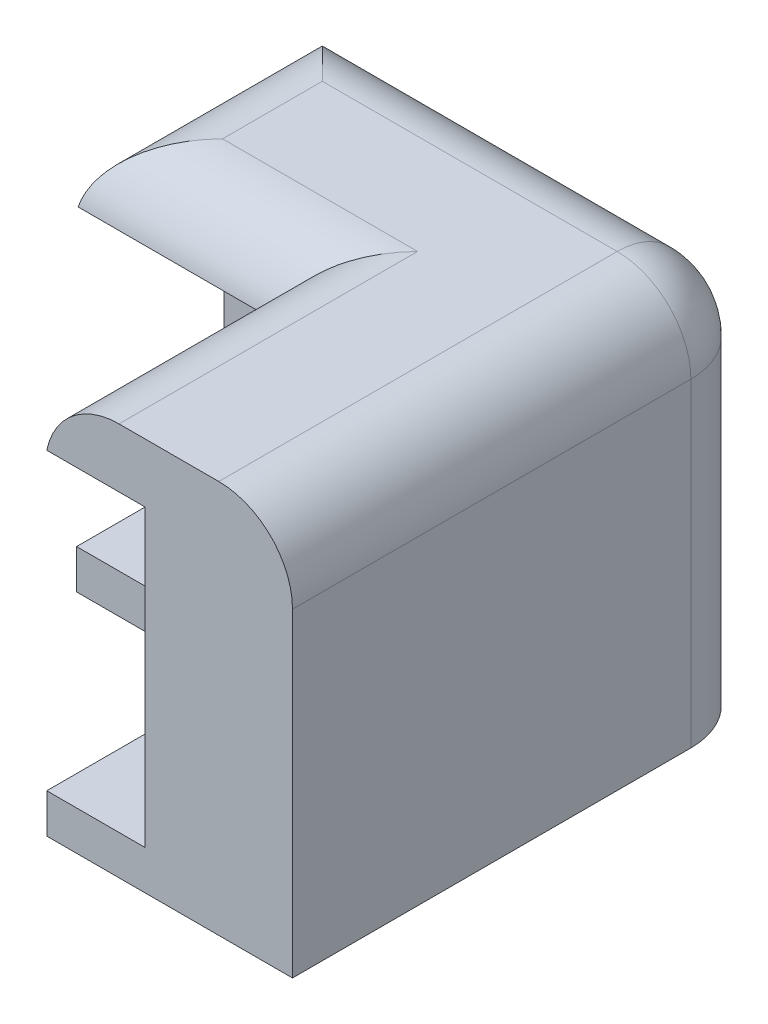
from build123d import *

# Parameters (mm, degrees)
SKETCH_221_W        = 218
SKETCH_221_H        = 134
SKETCH_221_W_2      = 198
SKETCH_221_H_2      = 114
EXTRUDE_2_DEPTH     = 16
SKETCH_2_W          = 126
SKETCH_2_H          = 12
CUT_EXTRUDE_1_DEPTH = 212
SKETCH_3_W          = 182
SKETCH_3_H          = 14.4
CUT_EXTRUDE_2_DEPTH = 134
SKETCH_4_R          = 1
CUT_EXTRUDE_3_DEPTH = 1.6
FILLET_1_R          = 3
FILLET_2_R          = 3
FILLET_3_R          = 3
SKETCH_6_W          = 206.897999361
SKETCH_6_H          = 19.177389722
CUT_EXTRUDE_5_DEPTH = 200
SKETCH_7_W          = 123.024935324
SKETCH_7_H          = 17.566945153
CUT_EXTRUDE_6_DEPTH = 300


with BuildPart() as part:
    # Sketch 221 → Бобышка-Вытянуть2 (new body)
    with BuildSketch(Plane(origin=(0, 0, 0), x_dir=(1, 0, 0), z_dir=(0, 1, 0))):
        Rectangle(SKETCH_221_W, SKETCH_221_H)
        Rectangle(SKETCH_221_W_2, SKETCH_221_H_2, mode=Mode.SUBTRACT)
    extrude(amount=EXTRUDE_2_DEPTH)

    # Эскиз2 → Вырез-Вытянуть1 (cut)
    with BuildSketch(Plane.ZY.offset(109)):
        with Locations((0, 7.6)):
            Rectangle(SKETCH_2_W, SKETCH_2_H)
    extrude(amount=-CUT_EXTRUDE_1_DEPTH, mode=Mode.SUBTRACT)

    # Эскиз3 → Вырез-Вытянуть2 (cut)
    with BuildSketch(Plane.XY.offset(67)):
        with Locations((0, 8.8)):
            Rectangle(SKETCH_3_W, SKETCH_3_H)
    extrude(amount=-CUT_EXTRUDE_2_DEPTH, mode=Mode.SUBTRACT)

    # Эскиз4 → Вырез-Вытянуть3 (cut)
    with BuildSketch(Plane(origin=(0, 1.6, 0), x_dir=(1, 0, 0), z_dir=(0, 1, 0))):
        with Locations(Location((-74.698916604, 62, 0), (0, 0, 270))):
            Circle(SKETCH_4_R)
        with Locations(Location((-74.698916604, -62, 0), (0, 0, 270))):
            Circle(SKETCH_4_R)
        with Locations(Location((74.698916604, -62, 0), (0, 0, 90))):
            Circle(SKETCH_4_R)
        with Locations(Location((74.698916604, 62, 0), (0, 0, 90))):
            Circle(SKETCH_4_R)
    extrude(amount=-CUT_EXTRUDE_3_DEPTH, mode=Mode.SUBTRACT)

    # Скругление1
    fillet_1_edges = [part.edges().sort_by_distance(p)[0] for p in [
        (109, 8, 67),
        (-109, 8, 67),
        (-109, 8, -67),
        (109, 8, -67),
    ]]
    fillet(fillet_1_edges, radius=FILLET_1_R)

    # Скругление2
    # the kernel refuses this fillet: 3 mm, written as the material it takes off along each edge
    with BuildSketch(Plane(origin=(-91, 16, -49.5), x_dir=(-1, 0, 0), z_dir=(0, 0, -1)), Plane(origin=(-91, 16, 74.5), x_dir=(-1, 0, 0), z_dir=(0, 0, -1))) as fillet_2_piece_1:
        with BuildLine():
            CenterArc((FILLET_2_R, -FILLET_2_R), FILLET_2_R, 90, 90)
            Line((0, -FILLET_2_R), (0, 0))
            Line((0, 0), (FILLET_2_R, 0))
        make_face()
    extrude(amount=25, mode=Mode.SUBTRACT)
    with BuildSketch(Plane(origin=(-83.651530772, 16, -57), x_dir=(0, 0, -1), z_dir=(-1, 0, 0)), Plane(origin=(-99, 16, 57), x_dir=(0, 0, 1), z_dir=(1, 0, 0))) as fillet_2_piece_2:
        with BuildLine():
            CenterArc((2.939387691, 3), FILLET_2_R, 191.536959033, 78.463040967)
            Line((0, 2.4), (0, 0))
            Line((0, 0), (2.939387691, 0))
        make_face()
    extrude(amount=15.348469228, mode=Mode.SUBTRACT)
    with BuildSketch(Plane(origin=(-99, 16, -57), x_dir=(-1, 0, 0), z_dir=(0, 0, 1))) as fillet_2_piece_3:
        with BuildLine():
            CenterArc((2.939387691, 3), FILLET_2_R, 191.536959033, 78.463040967)
            Line((0, 2.4), (0, 0))
            Line((0, 0), (2.939387691, 0))
        make_face()
    extrude(amount=114, mode=Mode.SUBTRACT)
    with BuildSketch(Plane(origin=(-106, 16, 67), x_dir=(0, -1, 0), z_dir=(1, 0, 0))) as fillet_2_piece_4:
        with BuildLine():
            CenterArc((FILLET_2_R, FILLET_2_R), FILLET_2_R, 180, 90)
            Line((0, FILLET_2_R), (0, 0))
            Line((0, 0), (FILLET_2_R, 0))
        make_face()
    extrude(amount=22.5, mode=Mode.SUBTRACT)
    with BuildSketch(Plane(origin=(-106, 16, 64), x_dir=(0, 0, 1), z_dir=(1, 0, 0))) as fillet_2_piece_5:
        with BuildLine():
            CenterArc((3 - FILLET_2_R, FILLET_2_R), FILLET_2_R, 270, 90)
            Line((3 - FILLET_2_R, 0), (3, 0))
            Line((3, 0), (3, FILLET_2_R))
        make_face()
    revolve(axis=Axis((-106, 16, 64), (0, -1, 0)), revolution_arc=90, mode=Mode.SUBTRACT)
    with BuildSketch(Plane(origin=(-109, 16, -64), x_dir=(1, 0, 0), z_dir=(0, 0, 1))) as fillet_2_piece_6:
        with BuildLine():
            CenterArc((FILLET_2_R, -FILLET_2_R), FILLET_2_R, 90, 90)
            Line((0, -FILLET_2_R), (0, 0))
            Line((0, 0), (FILLET_2_R, 0))
        make_face()
    extrude(amount=128, mode=Mode.SUBTRACT)
    with BuildSketch(Plane(origin=(-106, 16, -64), x_dir=(-1, 0, 0), z_dir=(0, 0, 1))) as fillet_2_piece_7:
        with BuildLine():
            CenterArc((3 - FILLET_2_R, FILLET_2_R), FILLET_2_R, 270, 90)
            Line((3, FILLET_2_R), (3, 0))
            Line((3, 0), (3 - FILLET_2_R, 0))
        make_face()
    revolve(axis=Axis((-106, 16, -64), (0, -1, 0)), revolution_arc=90, mode=Mode.SUBTRACT)
    with BuildSketch(Plane(origin=(-83.5, 16, -67), x_dir=(0, 0, 1), z_dir=(-1, 0, 0))) as fillet_2_piece_8:
        with BuildLine():
            CenterArc((FILLET_2_R, -FILLET_2_R), FILLET_2_R, 90, 90)
            Line((0, -FILLET_2_R), (0, 0))
            Line((0, 0), (FILLET_2_R, 0))
        make_face()
    extrude(amount=22.5, mode=Mode.SUBTRACT)
    with BuildSketch(Plane(origin=(-91, 16, -57), x_dir=(0, 0, -1), z_dir=(-1, 0, 0))) as fillet_2_piece_9a_section:
        with BuildLine():
            CenterArc((2.939387691, 3), FILLET_2_R, 191.536959033, 78.463040967)
            Line((0, 2.4), (0, 0))
            Line((0, 0), (2.939387691, 0))
        make_face()
    fillet_2_piece_9a = extrude(amount=15.348469228, mode=Mode.PRIVATE)
    fillet_2_piece_9a = split(fillet_2_piece_9a, bisect_by=Plane(origin=(-99, 16, -57), z_dir=(-1, 0, 0)), keep=Keep.TOP, mode=Mode.PRIVATE)
    with BuildSketch(Plane(origin=(-99, 16, -64.348469228), x_dir=(-1, 0, 0), z_dir=(0, 0, 1))) as fillet_2_piece_9b_section:
        with BuildLine():
            CenterArc((2.939387691, 3), FILLET_2_R, 191.536959033, 78.463040967)
            Line((0, 2.4), (0, 0))
            Line((0, 0), (2.939387691, 0))
        make_face()
    fillet_2_piece_9b = extrude(amount=121.348469228, mode=Mode.PRIVATE)
    fillet_2_piece_9b = split(fillet_2_piece_9b, bisect_by=Plane(origin=(-99, 16, -57), z_dir=(0, 0, -1)), keep=Keep.TOP, mode=Mode.PRIVATE)
    fillet_2_piece_9b = split(fillet_2_piece_9b, bisect_by=Plane(origin=(-99, 16, -63), z_dir=(0, 0, 1)), keep=Keep.TOP, mode=Mode.PRIVATE)
    fillet_2_piece_9 = fillet_2_piece_9a & fillet_2_piece_9b
    add(fillet_2_piece_9, mode=Mode.SUBTRACT)
    with BuildSketch(Plane(origin=(-106.348469228, 16, 57), x_dir=(0, 0, 1), z_dir=(1, 0, 0))) as fillet_2_piece_10a_section:
        with BuildLine():
            CenterArc((2.939387691, 3), FILLET_2_R, 191.536959033, 78.463040967)
            Line((0, 2.4), (0, 0))
            Line((0, 0), (2.939387691, 0))
        make_face()
    fillet_2_piece_10a = extrude(amount=15.348469228, mode=Mode.PRIVATE)
    fillet_2_piece_10a = split(fillet_2_piece_10a, bisect_by=Plane(origin=(-99, 16, 57), z_dir=(-1, 0, 0)), keep=Keep.TOP, mode=Mode.PRIVATE)
    with BuildSketch(Plane(origin=(-99, 16, -57), x_dir=(-1, 0, 0), z_dir=(0, 0, 1))) as fillet_2_piece_10b_section:
        with BuildLine():
            CenterArc((2.939387691, 3), FILLET_2_R, 191.536959033, 78.463040967)
            Line((0, 2.4), (0, 0))
            Line((0, 0), (2.939387691, 0))
        make_face()
    fillet_2_piece_10b = extrude(amount=121.348469228, mode=Mode.PRIVATE)
    fillet_2_piece_10b = split(fillet_2_piece_10b, bisect_by=Plane(origin=(-99, 16, 57), z_dir=(0, 0, 1)), keep=Keep.TOP, mode=Mode.PRIVATE)
    fillet_2_piece_10b = split(fillet_2_piece_10b, bisect_by=Plane(origin=(-99, 16, 63), z_dir=(0, 0, -1)), keep=Keep.TOP, mode=Mode.PRIVATE)
    fillet_2_piece_10 = fillet_2_piece_10a & fillet_2_piece_10b
    add(fillet_2_piece_10, mode=Mode.SUBTRACT)

    # Скругление3
    # the kernel refuses this fillet: 3 mm, written as the material it takes off along each edge
    with BuildSketch(Plane(origin=(106, 16, 64), x_dir=(0, 0, 1), z_dir=(-1, 0, 0))) as fillet_3_piece_1:
        with BuildLine():
            CenterArc((3 - FILLET_3_R, -FILLET_3_R), FILLET_3_R, 0, 90)
            Line((3, -FILLET_3_R), (3, 0))
            Line((3, 0), (3 - FILLET_3_R, 0))
        make_face()
    revolve(axis=Axis((106, 16, 64), (0, 1, 0)), revolution_arc=90, mode=Mode.SUBTRACT)
    with BuildSketch(Plane(origin=(83.5, 16, 67), x_dir=(0, -1, 0), z_dir=(1, 0, 0)), Plane(origin=(106, 16, -67), x_dir=(0, -1, 0), z_dir=(-1, 0, 0))) as fillet_3_piece_2:
        with BuildLine():
            CenterArc((FILLET_3_R, FILLET_3_R), FILLET_3_R, 180, 90)
            Line((0, FILLET_3_R), (0, 0))
            Line((0, 0), (FILLET_3_R, 0))
        make_face()
    extrude(amount=22.5, mode=Mode.SUBTRACT)
    with BuildSketch(Plane(origin=(91, 16, 74.5), x_dir=(0, -1, 0), z_dir=(0, 0, -1)), Plane(origin=(91, 16, -49.5), x_dir=(0, -1, 0), z_dir=(0, 0, -1))) as fillet_3_piece_3:
        with BuildLine():
            CenterArc((FILLET_3_R, -FILLET_3_R), FILLET_3_R, 90, 90)
            Line((0, -FILLET_3_R), (0, 0))
            Line((0, 0), (FILLET_3_R, 0))
        make_face()
    extrude(amount=25, mode=Mode.SUBTRACT)
    with BuildSketch(Plane(origin=(83.651530772, 16, 57), x_dir=(0, -1.0, 1.5720758028687117e-12), z_dir=(1, 0, 0)), Plane(origin=(99, 16, -57), x_dir=(0, -1.0, -1.5750363976010446e-12), z_dir=(-1, 0, 0))) as fillet_3_piece_4:
        with BuildLine():
            CenterArc((3, -2.939387691), FILLET_3_R, 101.536959033, 78.463040967)
            Line((0, -2.939387691), (0, 0))
            Line((0, 0), (2.4, 0))
        make_face()
    extrude(amount=15.348469228, mode=Mode.SUBTRACT)
    with BuildSketch(Plane(origin=(99, 16, 57), x_dir=(1.56911520813638e-12, -1.0, 0), z_dir=(0, 0, -1))) as fillet_3_piece_5:
        with BuildLine():
            CenterArc((3, -2.939387691), FILLET_3_R, 101.536959033, 78.463040967)
            Line((0, -2.939387691), (0, 0))
            Line((0, 0), (2.4, 0))
        make_face()
    extrude(amount=114, mode=Mode.SUBTRACT)
    with BuildSketch(Plane(origin=(106, 16, -64), x_dir=(1, 0, 0), z_dir=(0, 0, 1))) as fillet_3_piece_6:
        with BuildLine():
            CenterArc((3 - FILLET_3_R, -FILLET_3_R), FILLET_3_R, 0, 90)
            Line((3 - FILLET_3_R, 0), (3, 0))
            Line((3, 0), (3, -FILLET_3_R))
        make_face()
    revolve(axis=Axis((106, 16, -64), (0, 1, 0)), revolution_arc=90, mode=Mode.SUBTRACT)
    with BuildSketch(Plane(origin=(109, 16, 64), x_dir=(0, -1, 0), z_dir=(0, 0, -1))) as fillet_3_piece_7:
        with BuildLine():
            CenterArc((FILLET_3_R, FILLET_3_R), FILLET_3_R, 180, 90)
            Line((0, FILLET_3_R), (0, 0))
            Line((0, 0), (FILLET_3_R, 0))
        make_face()
    extrude(amount=128, mode=Mode.SUBTRACT)
    with BuildSketch(Plane(origin=(91, 16, 57), x_dir=(0, -1.0, 1.5720758028687117e-12), z_dir=(1, 0, 0))) as fillet_3_piece_8a_section:
        with BuildLine():
            CenterArc((3, -2.939387691), FILLET_3_R, 101.536959033, 78.463040967)
            Line((0, -2.939387691), (0, 0))
            Line((0, 0), (2.4, 0))
        make_face()
    fillet_3_piece_8a = extrude(amount=15.348469228, mode=Mode.PRIVATE)
    fillet_3_piece_8a = split(fillet_3_piece_8a, bisect_by=Plane(origin=(103, 16, 57), z_dir=(-1, 0, 0)), keep=Keep.TOP, mode=Mode.PRIVATE)
    fillet_3_piece_8a = split(fillet_3_piece_8a, bisect_by=Plane(origin=(99, 16, 57), z_dir=(1, 0, 0)), keep=Keep.TOP, mode=Mode.PRIVATE)
    with BuildSketch(Plane(origin=(99, 16, 64.348469228), x_dir=(1.56911520813638e-12, -1.0, 0), z_dir=(0, 0, -1))) as fillet_3_piece_8b_section:
        with BuildLine():
            CenterArc((3, -2.939387691), FILLET_3_R, 101.536959033, 78.463040967)
            Line((0, -2.939387691), (0, 0))
            Line((0, 0), (2.4, 0))
        make_face()
    fillet_3_piece_8b = extrude(amount=121.348469228, mode=Mode.PRIVATE)
    fillet_3_piece_8b = split(fillet_3_piece_8b, bisect_by=Plane(origin=(99, 16, 63), z_dir=(0, 0, -1)), keep=Keep.TOP, mode=Mode.PRIVATE)
    fillet_3_piece_8b = split(fillet_3_piece_8b, bisect_by=Plane(origin=(99, 16, 57), z_dir=(0, 0, 1)), keep=Keep.TOP, mode=Mode.PRIVATE)
    fillet_3_piece_8 = fillet_3_piece_8a & fillet_3_piece_8b
    add(fillet_3_piece_8, mode=Mode.SUBTRACT)
    with BuildSketch(Plane(origin=(99, 16, 57), x_dir=(1.56911520813638e-12, -1.0, 0), z_dir=(0, 0, -1))) as fillet_3_piece_9a_section:
        with BuildLine():
            CenterArc((3, -2.939387691), FILLET_3_R, 101.536959033, 78.463040967)
            Line((0, -2.939387691), (0, 0))
            Line((0, 0), (2.4, 0))
        make_face()
    fillet_3_piece_9a = extrude(amount=121.348469228, mode=Mode.PRIVATE)
    fillet_3_piece_9a = split(fillet_3_piece_9a, bisect_by=Plane(origin=(99, 16, -63), z_dir=(0, 0, 1)), keep=Keep.TOP, mode=Mode.PRIVATE)
    fillet_3_piece_9a = split(fillet_3_piece_9a, bisect_by=Plane(origin=(99, 16, -57), z_dir=(0, 0, -1)), keep=Keep.TOP, mode=Mode.PRIVATE)
    with BuildSketch(Plane(origin=(106.348469228, 16, -57), x_dir=(0, -1.0, -1.5750363976010446e-12), z_dir=(-1, 0, 0))) as fillet_3_piece_9b_section:
        with BuildLine():
            CenterArc((3, -2.939387691), FILLET_3_R, 101.536959033, 78.463040967)
            Line((0, -2.939387691), (0, 0))
            Line((0, 0), (2.4, 0))
        make_face()
    fillet_3_piece_9b = extrude(amount=15.348469228, mode=Mode.PRIVATE)
    fillet_3_piece_9b = split(fillet_3_piece_9b, bisect_by=Plane(origin=(103, 16, -57), z_dir=(-1, 0, 0)), keep=Keep.TOP, mode=Mode.PRIVATE)
    fillet_3_piece_9b = split(fillet_3_piece_9b, bisect_by=Plane(origin=(99, 16, -57), z_dir=(1, 0, 0)), keep=Keep.TOP, mode=Mode.PRIVATE)
    fillet_3_piece_9 = fillet_3_piece_9a & fillet_3_piece_9b
    add(fillet_3_piece_9, mode=Mode.SUBTRACT)

    # Эскиз6 → Вырез-Вытянуть5 (cut)
    with BuildSketch(Plane(origin=(0, 0, -67), x_dir=(-1, 0, 0), z_dir=(0, 0, -1))):
        with Locations((12.448999681, 9.588694861)):
            Rectangle(SKETCH_6_W, SKETCH_6_H)
    extrude(amount=-CUT_EXTRUDE_5_DEPTH, mode=Mode.SUBTRACT)

    # Эскиз7 → Вырез-Вытянуть6 (cut)
    with BuildSketch(Plane(origin=(109, 0, 0), x_dir=(0, 0, -1), z_dir=(1, 0, 0))):
        with Locations((-13.726045872, 8.783472577)):
            Rectangle(SKETCH_7_W, SKETCH_7_H)
    extrude(amount=-CUT_EXTRUDE_6_DEPTH, mode=Mode.SUBTRACT)


solid = part.part
